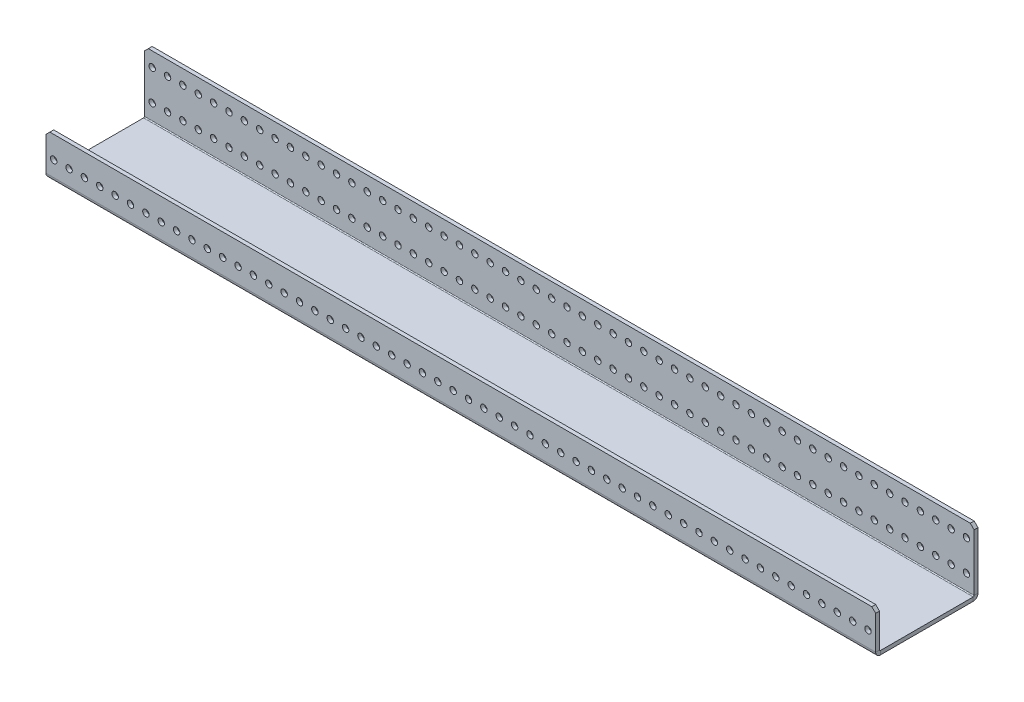
from build123d import *

# Parameters (mm, degrees)
SKETCH1_W                    = 787.4
SKETCH1_H                    = 78.232
BOSS_EXTRUDE1_DEPTH          = 3.175
EDGE_FLANGE1_STRIP_W         = 14.224
EDGE_FLANGE1_STRIP_H         = 3.175
EDGE_FLANGE1_STRIP_CUT_DEPTH = 787.4
EDGE_FLANGE1_DEPTH           = 787.4
EDGE_FLANGE2_STRIP_W         = 14.224
EDGE_FLANGE2_STRIP_H         = 3.175
EDGE_FLANGE2_STRIP_CUT_DEPTH = 787.4
EDGE_FLANGE2_DEPTH           = 787.4
SKETCH9_R                    = 2.667
CUT_EXTRUDE1_DEPTH           = 794.767078776
CHAMFER1_SIZE                = 3.175
LPATTERN1_COUNT              = 62
LPATTERN1_PITCH              = 12.7
SKETCH14_R                   = 2.667
CUT_EXTRUDE6_DEPTH           = 5.08
LPATTERN4_COUNT              = 62
LPATTERN4_PITCH              = 12.7
SKETCH15_W                   = 101.6
SKETCH15_H                   = 84.582
CUT_EXTRUDE7_DEPTH           = 794.435038471
CHAMFER2_SIZE                = 3.175


# Sheet-metal steps are written as plain solids
with BuildPart() as part:
    # Sketch1 → Boss-Extrude1 (new body)
    with BuildSketch(Plane(origin=(0, 0, 0), x_dir=(1, 0, 0), z_dir=(0, 1, 0))):
        with Locations((393.7, 39.116)):
            Rectangle(SKETCH1_W, SKETCH1_H)
    extrude(amount=BOSS_EXTRUDE1_DEPTH)

    # Edge-Flange1 strip (across the edge) → Edge-Flange1 strip cut (cut)
    with BuildSketch(Plane(origin=(787.4, 3.175, -78.232), x_dir=(0, 0, 1), z_dir=(-1, 0, 0))):
        with Locations((-6.35, -1.5875)):
            Rectangle(EDGE_FLANGE1_STRIP_W, EDGE_FLANGE1_STRIP_H)
    extrude(amount=EDGE_FLANGE1_STRIP_CUT_DEPTH, mode=Mode.SUBTRACT)

    # Edge-Flange1 section (across the edge) → Edge-Flange1 (add)
    with BuildSketch(Plane(origin=(787.4, 3.175, -78.232), x_dir=(0, 0, 1), z_dir=(-1, 0, 0))):
        with BuildLine():
            Line((-3.175, 0.762), (-3.175, 50.8))
            Line((-3.175, 50.8), (0, 50.8))
            Line((0, 50.8), (0, 0.762))
            ThreePointArc((0, 0.762), (0.223184633, 0.223184633), (0.762, 0))
            Line((0.762, 0), (0.762, -3.175))
            ThreePointArc((0.762, -3.175), (-2.021879398, -2.021879398), (-3.175, 0.762))
        make_face()
    extrude(amount=EDGE_FLANGE1_DEPTH)

    # Edge-Flange2 strip (across the edge) → Edge-Flange2 strip cut (cut)
    with BuildSketch(Plane(origin=(0, 3.175, 0), x_dir=(0, 0, -1), z_dir=(1, 0, 0))):
        with Locations((-6.35, -1.5875)):
            Rectangle(EDGE_FLANGE2_STRIP_W, EDGE_FLANGE2_STRIP_H)
    extrude(amount=EDGE_FLANGE2_STRIP_CUT_DEPTH, mode=Mode.SUBTRACT)

    # Edge-Flange2 section (across the edge) → Edge-Flange2 (add)
    with BuildSketch(Plane(origin=(0, 3.175, 0), x_dir=(0, 0, -1), z_dir=(1, 0, 0))):
        with BuildLine():
            Line((-3.175, 0.762), (-3.175, 31.75))
            Line((-3.175, 31.75), (0, 31.75))
            Line((0, 31.75), (0, 0.762))
            ThreePointArc((0, 0.762), (0.223184633, 0.223184633), (0.762, 0))
            Line((0.762, 0), (0.762, -3.175))
            ThreePointArc((0.762, -3.175), (-2.021879398, -2.021879398), (-3.175, 0.762))
        make_face()
    extrude(amount=EDGE_FLANGE2_DEPTH)

    # Sketch9 → Cut-Extrude1 (cut, through all)
    with BuildSketch(Plane.XY.offset(3.175)):
        with Locations((781.05, 16.637)):
            Circle(SKETCH9_R)
    cut_extrude1 = extrude(amount=-CUT_EXTRUDE1_DEPTH, mode=Mode.SUBTRACT)

    # Chamfer1
    chamfer1_edges = [part.edges().sort_by_distance(p)[0] for p in [
        (787.4, 53.975, -79.8195),
        (0, 53.975, -79.8195),
        (0, 34.925, 1.5875),
        (787.4, 34.925, 1.5875),
    ]]
    chamfer(chamfer1_edges, length=CHAMFER1_SIZE)

    # LPattern1: Cut-Extrude1 ×62
    with Locations(*[(-i * LPATTERN1_PITCH, 0, 0) for i in range(1, LPATTERN1_COUNT)]):
        add(cut_extrude1, mode=Mode.SUBTRACT)

    # Sketch14 → Cut-Extrude6 (cut)
    with BuildSketch(Plane(origin=(0, 0, -81.407), x_dir=(-1, 0, 0), z_dir=(0, 0, -1))):
        with Locations(Location((-781.05, 42.037, 0), (0, 0, 90))):
            Circle(SKETCH14_R)
    cut_extrude6 = extrude(amount=-CUT_EXTRUDE6_DEPTH, mode=Mode.SUBTRACT)

    # LPattern4: Cut-Extrude6 ×62
    with Locations(*[(-i * LPATTERN4_PITCH, 0, 0) for i in range(1, LPATTERN4_COUNT)]):
        add(cut_extrude6, mode=Mode.SUBTRACT)

    # Sketch15 → Cut-Extrude7 (cut, through all)
    with BuildSketch(Plane.XZ):
        with Locations((50.8, -39.116)):
            Rectangle(SKETCH15_W, SKETCH15_H)
    extrude(amount=-CUT_EXTRUDE7_DEPTH, mode=Mode.SUBTRACT)

    # Chamfer2
    chamfer2_edges = [part.edges().sort_by_distance(p)[0] for p in [
        (101.6, 34.925, 1.5875),
        (101.6, 53.975, -79.8195),
    ]]
    chamfer(chamfer2_edges, length=CHAMFER2_SIZE)


solid = part.part
